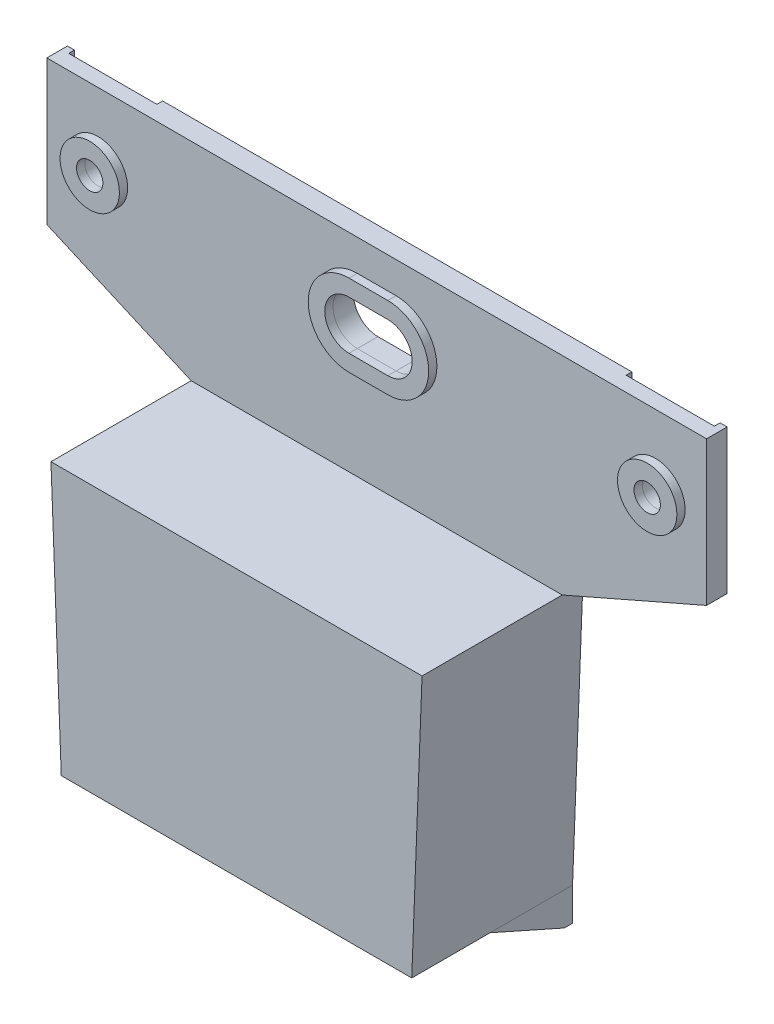
from build123d import *

# Parameters (mm, degrees)
MAIN_BODY_DEPTH                    = 6.35
POCKET_OUTER_SURFACE_DEPTH         = 43.18
POCKET_INSIDE_DEPTH                = 44.45
SKETCH8_W                          = 10.16
SKETCH8_H                          = 25.4
BOTTOM_SCREW_MOUNT_DEPTH           = 10.16
BOTTOM_SCREW_MOUNT_EXTRUSION_DEPTH = 10.16
LIGHT_SOCKETS_DEPTH                = 184.078329957
LIGHT_SOCKETS_DEPTH_BACK           = 6.35
SKETCH17_R                         = 4.064
SKETCH18_R                         = 9.144
LIGHT_LIP_LINERS_DEPTH             = 2.54
LIGHT_LIP_SOCKETS_REACH            = 185.078
SKETCH17_2_R                       = 4.064
TAB_SLOTS_DEPTH                    = 1.778


# Sheet-metal steps are written as plain solids
with BuildPart() as part:
    # Sketch1 → Main Body (new body)
    with BuildSketch(Plane.XY):
        Polygon((-53.975, 0), (53.975, 0), (57.15, 82.161327118), (101.6, 101.6), (101.6, 146.05), (-101.6, 146.05), (-101.6, 101.6), (-57.15, 82.161327118), align=None)
    extrude(amount=-MAIN_BODY_DEPTH)

    # Sketch6 → Pocket-Outer Surface (add)
    with BuildSketch(Plane.XY):
        Polygon((53.975, 0), (-53.975, 0), (-57.15, 82.161327118), (57.15, 82.161327118), align=None)
    extrude(amount=POCKET_OUTER_SURFACE_DEPTH)

    # Sketch7 → Pocket-Inside (cut)
    with BuildSketch(Plane(origin=(0, 0, -6.35), x_dir=(-1, 0, 0), z_dir=(0, 0, -1))):
        Polygon((-50.564894027, 76.2), (-47.86564661, 6.35), (47.86564661, 6.35), (50.564894027, 76.2), align=None)
    extrude(amount=-POCKET_INSIDE_DEPTH, mode=Mode.SUBTRACT)

    # Sketch8 → Bottom Screw Mount (add)
    with BuildSketch(Plane.XZ):
        with Locations((-48.895, 6.35)):
            Rectangle(SKETCH8_W, SKETCH8_H)
    bottom_screw_mount = extrude(amount=BOTTOM_SCREW_MOUNT_DEPTH)

    # Sketch9 → Bottom Screw Mount Extrusion (cut)
    with BuildSketch(Plane.ZY.offset(53.975)):
        Polygon((-3.81, -10.16), (19.05, -10.16), (19.05, 0), align=None)
    bottom_screw_mount_extrusion = extrude(amount=-BOTTOM_SCREW_MOUNT_EXTRUSION_DEPTH, mode=Mode.SUBTRACT)

    # Left Bottom Screw Mount: Bottom Screw Mount, Bottom Screw Mount Extrusion across plane
    add(bottom_screw_mount.mirror(Plane(origin=(0, 0, 0), x_dir=(0, 0, 1), z_dir=(1, 0, 0))))
    add(bottom_screw_mount_extrusion.mirror(Plane(origin=(0, 0, 0), x_dir=(0, 0, 1), z_dir=(1, 0, 0))), mode=Mode.SUBTRACT)

    # Sketch17 → Light Sockets (cut, two sides: drawn at the far end of the back side and taken through both)
    with BuildSketch(Plane.XY.offset(-LIGHT_SOCKETS_DEPTH_BACK)):
        with Locations((85.852, 123.825)):
            Circle(SKETCH17_R)
        with Locations((-85.852, 123.825)):
            Circle(SKETCH17_R)
        with BuildLine():
            Line((-5.969, 131.318), (5.969, 131.318))
            ThreePointArc((5.969, 131.318), (13.462, 123.825), (5.969, 116.332))
            Line((5.969, 116.332), (-5.969, 116.332))
            ThreePointArc((-5.969, 116.332), (-13.462, 123.825), (-5.969, 131.318))
        make_face()
    extrude(amount=LIGHT_SOCKETS_DEPTH + LIGHT_SOCKETS_DEPTH_BACK, mode=Mode.SUBTRACT)

    # Sketch18 → Light Lip Liners (add)
    with BuildSketch(Plane.XY):
        with Locations((-85.852, 123.825)):
            Circle(SKETCH18_R)
        with Locations((85.852, 123.825)):
            Circle(SKETCH18_R)
        with BuildLine():
            Line((5.969, 136.398), (-5.969, 136.398))
            ThreePointArc((-5.969, 136.398), (-18.542, 123.825), (-5.969, 111.252))
            Line((-5.969, 111.252), (5.969, 111.252))
            ThreePointArc((5.969, 111.252), (18.542, 123.825), (5.969, 136.398))
        make_face()
    extrude(amount=LIGHT_LIP_LINERS_DEPTH)

    # Sketch17<2> → Light Lip Sockets (cut, up to next)
    with BuildSketch(Plane.XY, mode=Mode.PRIVATE) as light_lip_sockets_sk1:
        with Locations((85.852, 123.825)):
            Circle(SKETCH17_2_R)
    light_lip_sockets_tool1 = extrude(light_lip_sockets_sk1.sketch, amount=LIGHT_LIP_SOCKETS_REACH, mode=Mode.PRIVATE) & part.part
    # Sketch17<2> → Light Lip Sockets (cut, up to next)
    with BuildSketch(Plane.XY, mode=Mode.PRIVATE) as light_lip_sockets_sk2:
        with Locations((-85.852, 123.825)):
            Circle(SKETCH17_2_R)
    light_lip_sockets_tool2 = extrude(light_lip_sockets_sk2.sketch, amount=LIGHT_LIP_SOCKETS_REACH, mode=Mode.PRIVATE) & part.part
    # Sketch17<2> → Light Lip Sockets (cut, up to next)
    with BuildSketch(Plane.XY, mode=Mode.PRIVATE) as light_lip_sockets_sk3:
        with BuildLine():
            Line((-5.969, 131.318), (5.969, 131.318))
            ThreePointArc((5.969, 131.318), (13.462, 123.825), (5.969, 116.332))
            Line((5.969, 116.332), (-5.969, 116.332))
            ThreePointArc((-5.969, 116.332), (-13.462, 123.825), (-5.969, 131.318))
        make_face()
    light_lip_sockets_tool3 = extrude(light_lip_sockets_sk3.sketch, amount=LIGHT_LIP_SOCKETS_REACH, mode=Mode.PRIVATE) & part.part
    add(light_lip_sockets_tool1.solids().sort_by_distance((85.852, 123.825, 0))[0], mode=Mode.SUBTRACT)
    add(light_lip_sockets_tool2.solids().sort_by_distance((-85.852, 123.825, 0))[0], mode=Mode.SUBTRACT)
    add(light_lip_sockets_tool3.solids().sort_by_distance((0, 123.825, 0))[0], mode=Mode.SUBTRACT)

    # Sketch19 → Tab Slots (cut)
    with BuildSketch(Plane(origin=(0, 0, -6.35), x_dir=(-1, 0, 0), z_dir=(0, 0, -1))):
        with BuildLine():
            Line((72.263, 146.05), (72.263, 123.825))
            ThreePointArc((72.263, 123.825), (85.852, 110.236), (99.441, 123.825))
            Line((99.441, 123.825), (99.441, 146.05))
            Line((99.441, 146.05), (72.263, 146.05))
        make_face()
    tab_slots = extrude(amount=-TAB_SLOTS_DEPTH, mode=Mode.SUBTRACT)

    # Mirror3: Tab Slots across plane
    add(tab_slots.mirror(Plane(origin=(0, 0, 0), x_dir=(0, 0, 1), z_dir=(1, 0, 0))), mode=Mode.SUBTRACT)


solid = part.part
